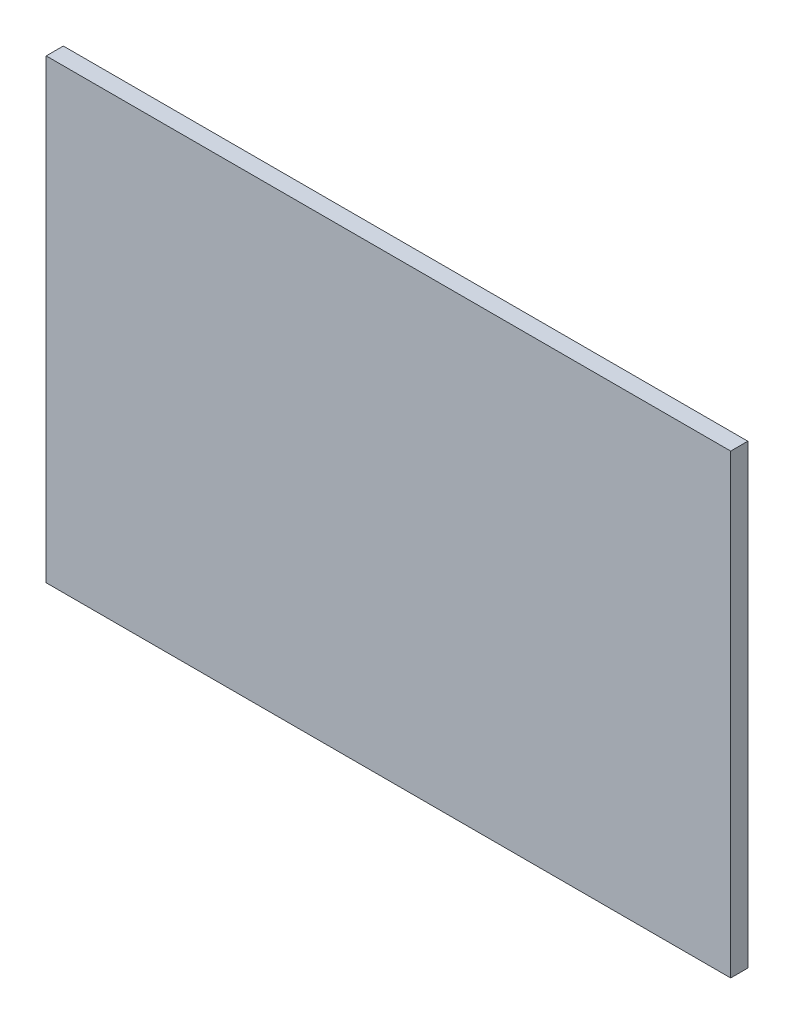
from build123d import *

# Parameters (mm, degrees)
SKETCH_1_W      = 120
SKETCH_1_H      = 80
EXTRUDE_1_DEPTH = 3


with BuildPart() as part:
    # Эскиз1 → Бобышка-Вытянуть1 (new body)
    with BuildSketch(Plane.XY):
        Rectangle(SKETCH_1_W, SKETCH_1_H)
    extrude(amount=EXTRUDE_1_DEPTH)


solid = part.part
